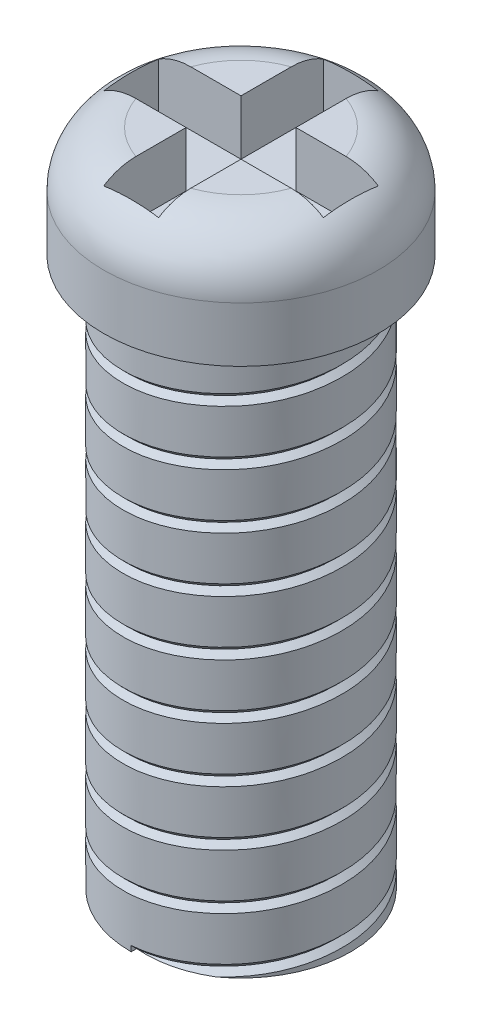
from build123d import *

# Parameters (mm, degrees)
CROQUIS2_R              = 2.5
SALIENTE_EXTRUIR1_DEPTH = 12
CROQUIS3_R              = 2.5
CROQUIS3_R_2            = 2
CORTAR_EXTRUIR2_DEPTH   = 10
CORTAR_BARRER1_PITCH    = 1
CORTAR_BARRER1_HEIGHT   = 10
CORTAR_BARRER1_RADIUS   = 1.9
REDONDEO4_R             = 1
CROQUIS7_W              = 4
CROQUIS7_H              = 1
CROQUIS7_W_2            = 1
CROQUIS7_H_2            = 4
CORTAR_EXTRUIR3_DEPTH   = 1


with BuildPart() as part:
    # Croquis2 → Saliente-Extruir1 (new body)
    with BuildSketch(Plane(origin=(0, 0, 0), x_dir=(1, 0, 0), z_dir=(0, 1, 0))):
        with Locations(Location((0, 0, 0), (0, 0, 270))):
            Circle(CROQUIS2_R)
    extrude(amount=SALIENTE_EXTRUIR1_DEPTH)

    # Croquis3 → Cortar-Extruir2 (cut)
    with BuildSketch(Plane.XZ):
        with Locations(Location((0, 0, 0), (0, 0, 270))):
            Circle(CROQUIS3_R)
        with Locations(Location((0, 0, 0), (0, 0, 270))):
            Circle(CROQUIS3_R_2, mode=Mode.SUBTRACT)
    extrude(amount=-CORTAR_EXTRUIR2_DEPTH, mode=Mode.SUBTRACT)

    # Cortar-Barrer1: sweep along a helix
    with BuildLine() as cortar_barrer1_path:
        Helix(CORTAR_BARRER1_PITCH, CORTAR_BARRER1_HEIGHT, CORTAR_BARRER1_RADIUS, center=(0, 0, 0), direction=(0, 1, 0))
    # Croquis6 → Cortar-Barrer1 (sweep, cut)
    with BuildSketch(Plane(origin=(0, 0, 0), x_dir=(0, 0, -1), z_dir=(1, 0, 0))):
        Polygon((-1.9, 0), (-2.123412111, 0.223412111), (-2.123412111, -0.223412111), align=None)
    sweep(path=cortar_barrer1_path.line, is_frenet=True, mode=Mode.SUBTRACT)

    # Redondeo4
    redondeo4_edges = [part.edges().sort_by_distance(p)[0] for p in [
        (0, 12, -2.5),
    ]]
    fillet(redondeo4_edges, radius=REDONDEO4_R)

    # Croquis7 → Cortar-Extruir3 (cut)
    with BuildSketch(Plane(origin=(0, 12, 0), x_dir=(1, 0, 0), z_dir=(0, 1, 0))):
        Rectangle(CROQUIS7_W, CROQUIS7_H)
        Rectangle(CROQUIS7_W_2, CROQUIS7_H_2)
    extrude(amount=-CORTAR_EXTRUIR3_DEPTH, mode=Mode.SUBTRACT)


solid = part.part
